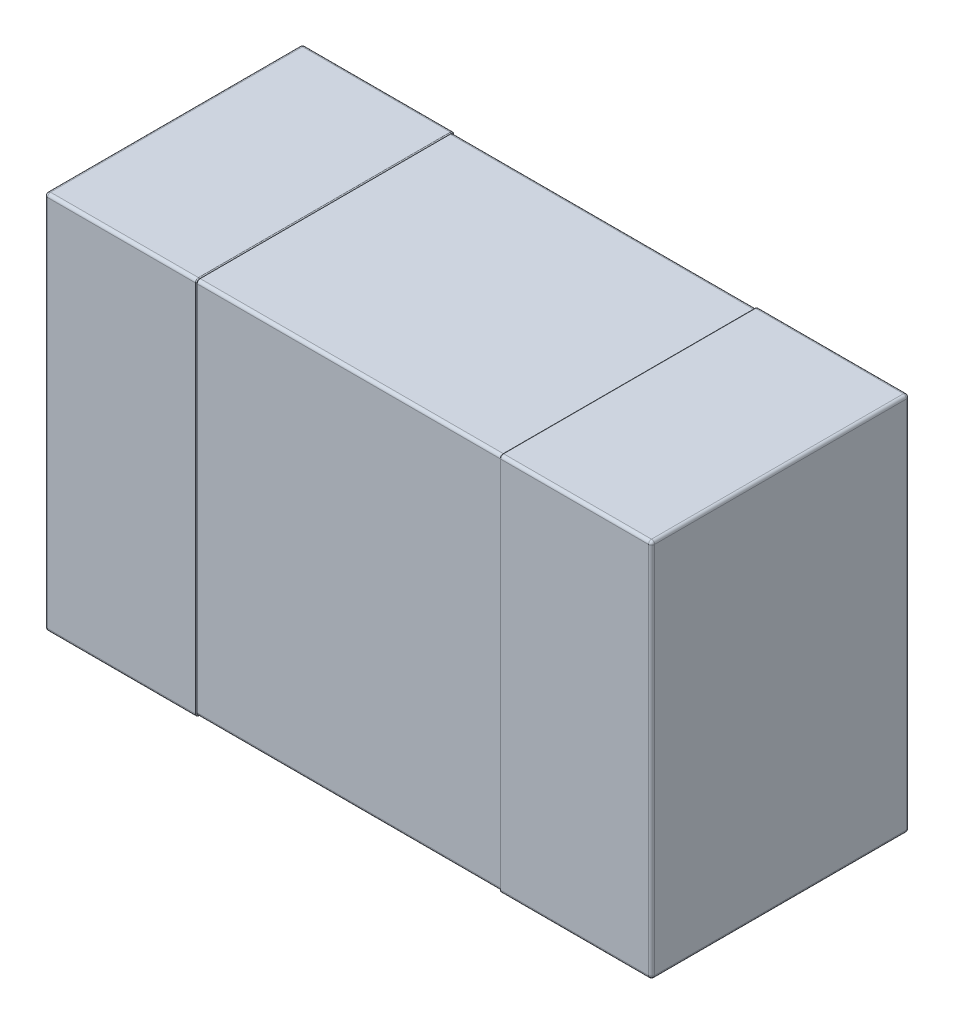
from build123d import *

# Parameters (mm, degrees)
SKETCH1_W                           = 2
SKETCH1_H                           = 1.25
ALL_BODY_DEPTH                      = 0.85
CUT_OUT_THE_BODY_FOR_PIN_DEPTH      = 0.5
CUT_OUT_THE_BODY_FOR_PIN_DEPTH_BACK = 0.5
SKETCH2_OUTSIDE_W                   = 3.352
SKETCH2_OUTSIDE_H                   = 3.752
SKETCH2_OUTSIDE_W_2                 = 0.844
SKETCH2_OUTSIDE_H_2                 = 1.244
BODY_FILLET_R                       = 0.01
PIN_FILLET_A_R                      = 0.01
PIN_FILLET_B_R                      = 0.003


with BuildPart() as part:
    # Sketch1 → All body (new body)
    with BuildSketch(Plane.XY):
        Rectangle(SKETCH1_W, SKETCH1_H)
    extrude(amount=ALL_BODY_DEPTH)

    # Sketch2 outside → Cut out the body for pin (cut, two sides: drawn at the far end of the back side and taken through both)
    with BuildSketch(Plane(origin=(0, 0, 0), x_dir=(0, 0, -1), z_dir=(1, 0, 0)).offset(-CUT_OUT_THE_BODY_FOR_PIN_DEPTH_BACK)):
        with Locations((-0.425, 0)):
            Rectangle(SKETCH2_OUTSIDE_W, SKETCH2_OUTSIDE_H)
        with Locations((-0.425, 0)):
            Rectangle(SKETCH2_OUTSIDE_W_2, SKETCH2_OUTSIDE_H_2, mode=Mode.SUBTRACT)
    extrude(amount=CUT_OUT_THE_BODY_FOR_PIN_DEPTH + CUT_OUT_THE_BODY_FOR_PIN_DEPTH_BACK, mode=Mode.SUBTRACT)

    # Body fillet
    body_fillet_edges = [part.edges().sort_by_distance(p)[0] for p in [
        (0, 0.622, 0.003),
        (0, 0.622, 0.847),
        (0, -0.622, 0.847),
        (0, -0.622, 0.003),
    ]]
    fillet(body_fillet_edges, radius=BODY_FILLET_R)

    # Pin fillet a
    pin_fillet_a_edges = [part.edges().sort_by_distance(p)[0] for p in [
        (1, 0, 0.85),
        (-0.75, 0.625, 0),
        (0.75, -0.625, 0),
        (0.75, -0.625, 0.85),
        (-0.75, 0.625, 0.85),
        (0.75, 0.625, 0.85),
        (-1, 0, 0.85),
        (0.75, 0.625, 0),
        (1, 0, 0),
        (-0.75, -0.625, 0),
        (-1, 0, 0),
        (-1, 0.625, 0.425),
        (1, 0.625, 0.425),
        (1, -0.625, 0.425),
        (-1, -0.625, 0.425),
        (-0.75, -0.625, 0.85),
    ]]
    fillet(pin_fillet_a_edges, radius=PIN_FILLET_A_R)

    # Pin fillet b
    pin_fillet_b_edges = [part.edges().sort_by_distance(p)[0] for p in [
        (0.5, -0.625, 0.425),
        (0.5, 0, 0.85),
        (0.5, 0.625, 0.425),
        (0.5, 0, 0),
        (-0.5, 0.625, 0.425),
        (-0.5, 0, 0.85),
        (-0.5, -0.625, 0.425),
        (-0.5, 0, 0),
        (0.5, 0.622071068, 0.002928932),
        (0.5, -0.622071068, 0.002928932),
        (0.5, -0.622071068, 0.847071068),
        (0.5, 0.622071068, 0.847071068),
        (-0.5, -0.622071068, 0.847071068),
        (-0.5, 0.622071068, 0.847071068),
        (-0.5, -0.622071068, 0.002928932),
        (-0.5, 0.622071068, 0.002928932),
    ]]
    fillet(pin_fillet_b_edges, radius=PIN_FILLET_B_R - 0.0001)  # a hair under: the kernel refuses the full size


solid = part.part
